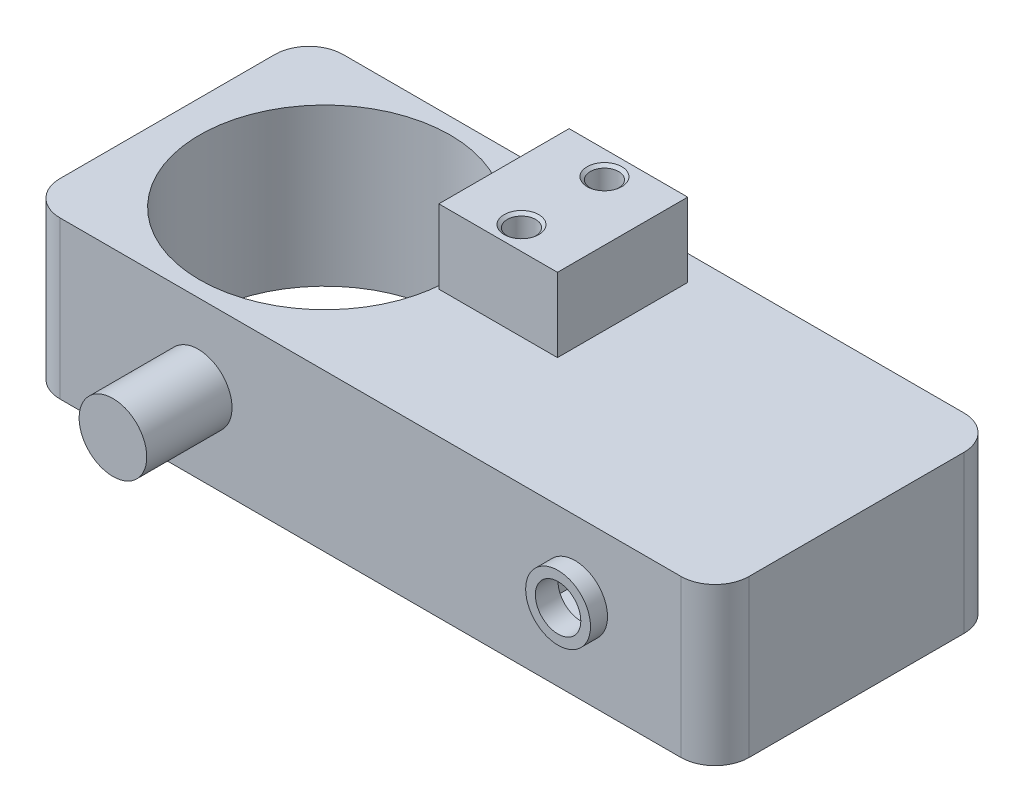
from build123d import *

# Parameters (mm, degrees)
SKETCH_1_W          = 60.60764715
SKETCH_1_H          = 24.895940982
EXTRUDE_1_DEPTH     = 13.8
SKETCH_2_W          = 12.5
SKETCH_2_H          = 10.5
CUT_EXTRUDE_1_DEPTH = 42.576070048
SKETCH_3_W          = 12.5
SKETCH_3_H          = 10.5
EXTRUDE_2_DEPTH     = 0.5
SKETCH_4_R          = 2
CUT_EXTRUDE_2_DEPTH = 42.278610196
SKETCH_5_R          = 2.975
EXTRUDE_3_DEPTH     = 7.5
SKETCH_10_W         = 10.431635196
SKETCH_10_H         = 11.456709174
EXTRUDE_4_DEPTH     = 6.5
SKETCH_14_R         = 2.850486714
SKETCH_14_R_2       = 2
EXTRUDE_5_DEPTH     = 1.5
SKETCH_22_R         = 11.026465904
CUT_EXTRUDE_5_DEPTH = 42.573227563
FILLET_1_R          = 3
FILLET_2_R          = 3
FILLET_3_R          = 3
FILLET_4_R          = 3


# Read off the part's stored shape, not the designer's step: M3 螺紋孔3
with BuildPart() as part:
    # 草圖1 → 填料-伸長1 (new body)
    with BuildSketch(Plane(origin=(0, 0, 0), x_dir=(1, 0, 0), z_dir=(0, 1, 0))):
        Rectangle(SKETCH_1_W, SKETCH_1_H)
    extrude(amount=EXTRUDE_1_DEPTH)

    # 草圖2 → 除料-伸長1 (cut, through all)
    with BuildSketch(Plane.XY.offset(12.447970491)):
        with Locations((18, 7.5)):
            Rectangle(SKETCH_2_W, SKETCH_2_H)
    extrude(amount=-CUT_EXTRUDE_1_DEPTH, mode=Mode.SUBTRACT)

    # 草圖3 → 填料-伸長2 (add)
    with BuildSketch(Plane.XY.offset(12.447970491)):
        with Locations((18, 7.5)):
            Rectangle(SKETCH_3_W, SKETCH_3_H)
    extrude(amount=-EXTRUDE_2_DEPTH)

    # 草圖4 → 除料-伸長2 (cut, through all)
    with BuildSketch(Plane(origin=(0, 0, 11.947970491), x_dir=(-1, 0, 0), z_dir=(0, 0, -1))):
        with Locations((-18, 7.5)):
            Circle(SKETCH_4_R)
    extrude(amount=-CUT_EXTRUDE_2_DEPTH, mode=Mode.SUBTRACT)

    # 草圖5 → 填料-伸長3 (add)
    with BuildSketch(Plane.XY.offset(12.447970491)):
        with Locations(Location((-15.151911787, 6.9, 0), (0, 0, 180))):
            Circle(SKETCH_5_R)
    extrude(amount=EXTRUDE_3_DEPTH)

    # 草圖10 → 填料-伸長4 (add)
    with BuildSketch(Plane(origin=(0, 13.8, 0), x_dir=(1, 0, 0), z_dir=(0, 1, 0))):
        with Locations((0, 4.510890299)):
            Rectangle(SKETCH_10_W, SKETCH_10_H)
    extrude(amount=EXTRUDE_4_DEPTH)

    # M3 螺紋孔3 outline → M3 螺紋孔3 (revolve, cut)
    with BuildSketch(Plane.XY.offset(-8.13268367)):
        Polygon((0, 0), (1.25, 0), (1.25, 20.069247601), (1.525, 20.3), (0, 20.3), align=None)
    revolve(axis=Axis((0, 0, -8.13268367), (0, 1, 0)), mode=Mode.SUBTRACT)

    # Hole Wizard M3 _3 2 outline → Hole Wizard M3 _3 2 (revolve, cut)
    with BuildSketch(Plane.XY.offset(-0.83268367)):
        Polygon((0, 0), (1.25, 0), (1.25, 20.069247601), (1.525, 20.3), (0, 20.3), align=None)
    revolve(axis=Axis((0, 0, -0.83268367), (0, 1, 0)), mode=Mode.SUBTRACT)

    # 草圖14 → 填料-伸長5 (add)
    with BuildSketch(Plane.XY.offset(12.447970491)):
        with Locations(Location((18, 7.5, 0), (0, 0, 180))):
            Circle(SKETCH_14_R)
        with Locations(Location((18, 7.5, 0), (0, 0, 180))):
            Circle(SKETCH_14_R_2, mode=Mode.SUBTRACT)
    extrude(amount=EXTRUDE_5_DEPTH)

    # 草圖22 → 除料-伸長5 (cut, through all)
    with BuildSketch(Plane.XZ):
        with Locations(Location((-16.460754219, 0, 0), (0, 0, 270))):
            Circle(SKETCH_22_R)
    extrude(amount=-CUT_EXTRUDE_5_DEPTH, mode=Mode.SUBTRACT)

    # 圓角1
    fillet_1_edges = [part.edges().sort_by_distance(p)[0] for p in [
        (-30.303823575, 6.9, -12.447970491),
    ]]
    fillet(fillet_1_edges, radius=FILLET_1_R)

    # 圓角2
    fillet_2_edges = [part.edges().sort_by_distance(p)[0] for p in [
        (-30.303823575, 6.9, 12.447970491),
    ]]
    fillet(fillet_2_edges, radius=FILLET_2_R)

    # 圓角3
    fillet_3_edges = [part.edges().sort_by_distance(p)[0] for p in [
        (30.303823575, 6.9, -12.447970491),
    ]]
    fillet(fillet_3_edges, radius=FILLET_3_R)

    # 圓角4
    fillet_4_edges = [part.edges().sort_by_distance(p)[0] for p in [
        (30.303823575, 6.9, 12.447970491),
    ]]
    fillet(fillet_4_edges, radius=FILLET_4_R)


solid = part.part
